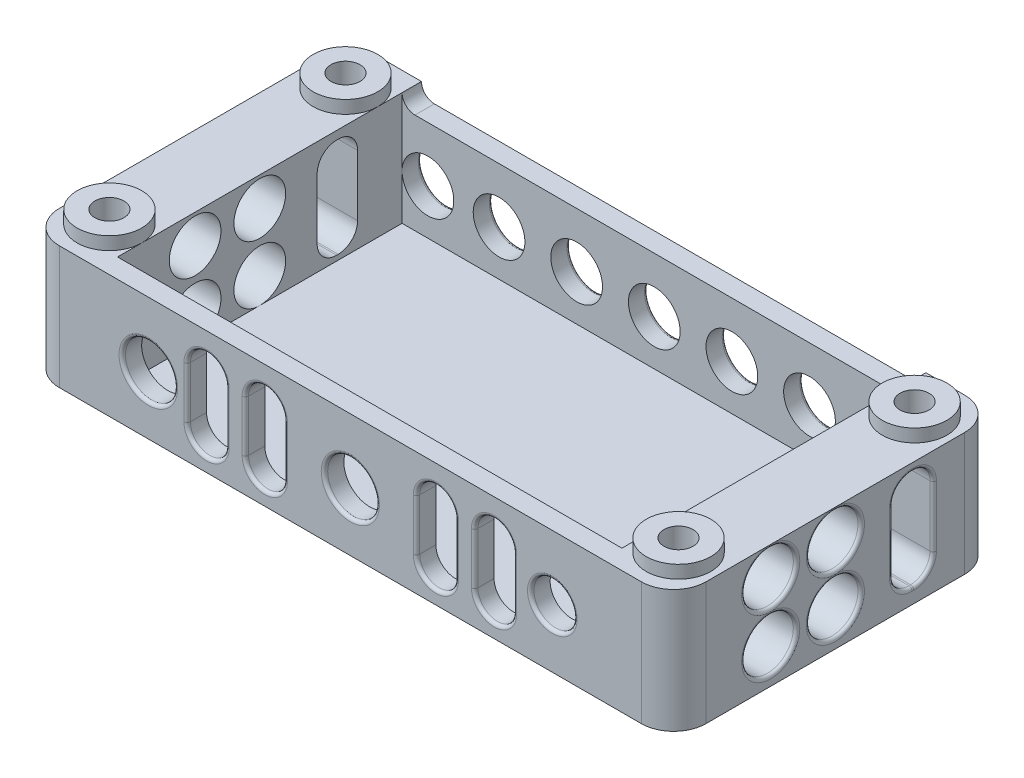
from build123d import *

# Parameters (mm, degrees)
CROQUIS1_W              = 100
CROQUIS1_H              = 50
CROQUIS1_R              = 2.25
SALIENTE_EXTRUIR2_DEPTH = 20
CROQUIS3_W              = 78
CROQUIS3_H              = 44
CORTAR_EXTRUIR1_DEPTH   = 18.5
CROQUIS4_R              = 4
CROQUIS4_W              = 6.257655616
CROQUIS4_H              = 15.417971864
CORTAR_EXTRUIR2_DEPTH   = 18.5
CROQUIS5_R              = 4
CORTAR_EXTRUIR3_DEPTH   = 18.5
REDONDEO1_R             = 5
CROQUIS8_W              = 78
CROQUIS8_H              = 3
CORTAR_EXTRUIR4_DEPTH   = 3
REDONDEO2_R             = 2
CROQUIS9_W              = 114.475750888
CROQUIS9_H              = 62.589988472
CROQUIS9_R              = 5
CORTAR_EXTRUIR6_DEPTH   = 1
REDONDEO3_R             = 3
CROQUIS12_R             = 5
CROQUIS12_R_2           = 2.25
SALIENTE_EXTRUIR4_DEPTH = 1
CROQUIS13_R             = 4
CROQUIS13_R_2           = 3.337538413
CROQUIS13_R_3           = 4.030830943
CORTAR_EXTRUIR8_DEPTH   = 10
CROQUIS14_R             = 4
CORTAR_EXTRUIR9_DEPTH   = 33
CROQUIS16_R             = 4
CORTAR_EXTRUIR10_DEPTH  = 20
REDONDEO6_R             = 0.5


with BuildPart() as part:
    # Croquis1 → Saliente-Extruir2 (new body)
    with BuildSketch(Plane(origin=(0, 0, 0), x_dir=(1, 0, 0), z_dir=(0, 1, 0))):
        Rectangle(CROQUIS1_W, CROQUIS1_H)
        with Locations(Location((-44, 18.25, 0), (0, 0, 270))):
            Circle(CROQUIS1_R, mode=Mode.SUBTRACT)
        with Locations(Location((44, 18.25, 0), (0, 0, 270))):
            Circle(CROQUIS1_R, mode=Mode.SUBTRACT)
        with Locations(Location((44, -18.25, 0), (0, 0, 270))):
            Circle(CROQUIS1_R, mode=Mode.SUBTRACT)
        with Locations(Location((-44, -18.25, 0), (0, 0, 270))):
            Circle(CROQUIS1_R, mode=Mode.SUBTRACT)
    extrude(amount=SALIENTE_EXTRUIR2_DEPTH)

    # Croquis3 → Cortar-Extruir1 (cut)
    with BuildSketch(Plane(origin=(0, 20, 0), x_dir=(1, 0, 0), z_dir=(0, 1, 0))):
        Rectangle(CROQUIS3_W, CROQUIS3_H)
    extrude(amount=-CORTAR_EXTRUIR1_DEPTH, mode=Mode.SUBTRACT)

    # Croquis4 → Cortar-Extruir2 (cut)
    with BuildSketch(Plane.ZY.offset(50)):
        with Locations((0, 14.5)):
            Circle(CROQUIS4_R)
        with Locations((10, 14.5)):
            Circle(CROQUIS4_R)
        with Locations((10, 5.5)):
            Circle(CROQUIS4_R)
        with Locations((0, 5.5)):
            Circle(CROQUIS4_R)
        with Locations((-12, 10)):
            Rectangle(CROQUIS4_W, CROQUIS4_H)
    extrude(amount=-CORTAR_EXTRUIR2_DEPTH, mode=Mode.SUBTRACT)

    # Croquis5 → Cortar-Extruir3 (cut)
    with BuildSketch(Plane.ZY.offset(-39)):
        with Locations((10, 14.5)):
            Circle(CROQUIS5_R)
        with Locations((0, 14.5)):
            Circle(CROQUIS5_R)
    extrude(amount=-CORTAR_EXTRUIR3_DEPTH, mode=Mode.SUBTRACT)

    # Redondeo1
    redondeo1_edges = [part.edges().sort_by_distance(p)[0] for p in [
        (50, 10, 25),
        (-50, 10, 25),
        (-50, 10, -25),
        (50, 10, -25),
    ]]
    fillet(redondeo1_edges, radius=REDONDEO1_R)

    # Croquis8 → Cortar-Extruir4 (cut)
    with BuildSketch(Plane(origin=(0, 20, 0), x_dir=(1, 0, 0), z_dir=(0, 1, 0))):
        with Locations((0, 23.5)):
            Rectangle(CROQUIS8_W, CROQUIS8_H)
    extrude(amount=-CORTAR_EXTRUIR4_DEPTH, mode=Mode.SUBTRACT)

    # Redondeo2
    redondeo2_edges = [part.edges().sort_by_distance(p)[0] for p in [
        (-39, 17, -23.5),
        (39, 17, -23.5),
    ]]
    fillet(redondeo2_edges, radius=REDONDEO2_R)

    # Croquis9 → Cortar-Extruir6 (cut)
    with BuildSketch(Plane(origin=(0, 20, 0), x_dir=(1, 0, 0), z_dir=(0, 1, 0))):
        Rectangle(CROQUIS9_W, CROQUIS9_H)
        with Locations(Location((44, -18.25, 0), (0, 0, 270))):
            Circle(CROQUIS9_R, mode=Mode.SUBTRACT)
        with Locations(Location((44, 18.25, 0), (0, 0, 270))):
            Circle(CROQUIS9_R, mode=Mode.SUBTRACT)
        with Locations(Location((-44, 18.25, 0), (0, 0, 270))):
            Circle(CROQUIS9_R, mode=Mode.SUBTRACT)
        with Locations(Location((-44, -18.25, 0), (0, 0, 270))):
            Circle(CROQUIS9_R, mode=Mode.SUBTRACT)
    extrude(amount=-CORTAR_EXTRUIR6_DEPTH, mode=Mode.SUBTRACT)

    # Redondeo3
    redondeo3_edges = [part.edges().sort_by_distance(p)[0] for p in [
        (-44.5, 17.708985932, -8.871172192),
        (-44.5, 2.291014068, -8.871172192),
        (-44.5, 2.291014068, -15.128827808),
        (-44.5, 17.708985932, -15.128827808),
    ]]
    fillet(redondeo3_edges, radius=REDONDEO3_R)

    # Croquis12 → Saliente-Extruir4 (add)
    # profile 1 of 4: a face of its own
    with BuildSketch(Plane(origin=(0, 20, 0), x_dir=(1, 0, 0), z_dir=(0, 1, 0))):
        with Locations(Location((44, -18.25, 0), (0, 0, 270))):
            Circle(CROQUIS12_R)
        with Locations(Location((44, -18.25, 0), (0, 0, 270))):
            Circle(CROQUIS12_R_2, mode=Mode.SUBTRACT)
    # profile 2 of 4: a face of its own
    with BuildSketch(Plane(origin=(0, 20, 0), x_dir=(1, 0, 0), z_dir=(0, 1, 0))):
        with Locations(Location((44, 18.25, 0), (0, 0, 270))):
            Circle(CROQUIS12_R)
        with Locations(Location((44, 18.25, 0), (0, 0, 270))):
            Circle(CROQUIS12_R_2, mode=Mode.SUBTRACT)
    # profile 3 of 4: a face of its own
    with BuildSketch(Plane(origin=(0, 20, 0), x_dir=(1, 0, 0), z_dir=(0, 1, 0))):
        with Locations(Location((-44, -18.25, 0), (0, 0, 270))):
            Circle(CROQUIS12_R)
        with Locations(Location((-44, -18.25, 0), (0, 0, 270))):
            Circle(CROQUIS12_R_2, mode=Mode.SUBTRACT)
    # profile 4 of 4: a face of its own
    with BuildSketch(Plane(origin=(0, 20, 0), x_dir=(1, 0, 0), z_dir=(0, 1, 0))):
        with Locations(Location((-44, 18.25, 0), (0, 0, 270))):
            Circle(CROQUIS12_R)
        with Locations(Location((-44, 18.25, 0), (0, 0, 270))):
            Circle(CROQUIS12_R_2, mode=Mode.SUBTRACT)
    extrude(amount=SALIENTE_EXTRUIR4_DEPTH)

    # Croquis13 → Cortar-Extruir8 (cut)
    with BuildSketch(Plane.XY.offset(25)):
        with Locations((0, 9.031278103)):
            Circle(CROQUIS13_R)
        with Locations((31.231612765, 9.031278103)):
            Circle(CROQUIS13_R_2)
        with Locations((-31.231612765, 9.031278103)):
            Circle(CROQUIS13_R_3)
        with BuildLine():
            Line((16.231612765, 13), (16.231612765, 5.062556207))
            ThreePointArc((16.231612765, 5.062556207), (13.231612765, 2.062556207), (10.231612765, 5.062556207))
            Line((10.231612765, 5.062556207), (10.231612765, 13))
            ThreePointArc((10.231612765, 13), (13.231612765, 16), (16.231612765, 13))
        make_face()
        with BuildLine():
            Line((-10.231612765, 13), (-10.231612765, 5.062556207))
            ThreePointArc((-10.231612765, 5.062556207), (-13.231612765, 2.062556207), (-16.231612765, 5.062556207))
            Line((-16.231612765, 5.062556207), (-16.231612765, 13))
            ThreePointArc((-16.231612765, 13), (-13.231612765, 16), (-10.231612765, 13))
        make_face()
        with BuildLine():
            Line((25.231612765, 13), (25.231612765, 5.062556207))
            ThreePointArc((25.231612765, 5.062556207), (22.231612765, 2.062556207), (19.231612765, 5.062556207))
            Line((19.231612765, 5.062556207), (19.231612765, 13))
            ThreePointArc((19.231612765, 13), (22.231612765, 16), (25.231612765, 13))
        make_face()
        with BuildLine():
            Line((-19.231612765, 13), (-19.231612765, 5.062556207))
            ThreePointArc((-19.231612765, 5.062556207), (-22.231612765, 2.062556207), (-25.231612765, 5.062556207))
            Line((-25.231612765, 5.062556207), (-25.231612765, 13))
            ThreePointArc((-25.231612765, 13), (-22.231612765, 16), (-19.231612765, 13))
        make_face()
    extrude(amount=-CORTAR_EXTRUIR8_DEPTH, mode=Mode.SUBTRACT)

    # Croquis14 → Cortar-Extruir9 (cut)
    with BuildSketch(Plane(origin=(50, 0, 0), x_dir=(0, 0, -1), z_dir=(1, 0, 0))):
        with Locations(Location((0, 5.5, 0), (0, 0, 180))):
            Circle(CROQUIS14_R)
        with Locations(Location((-10, 5.5, 0), (0, 0, 180))):
            Circle(CROQUIS14_R)
        with BuildLine():
            Line((12.128827808, 2.291014068), (11.871172192, 2.291014068))
            ThreePointArc((11.871172192, 2.291014068), (9.749851848, 3.169693724), (8.871172192, 5.291014068))
            Line((8.871172192, 5.291014068), (8.871172192, 14.708985932))
            ThreePointArc((8.871172192, 14.708985932), (9.749851848, 16.830306276), (11.871172192, 17.708985932))
            Line((11.871172192, 17.708985932), (12.128827808, 17.708985932))
            ThreePointArc((12.128827808, 17.708985932), (14.250148152, 16.830306276), (15.128827808, 14.708985932))
            Line((15.128827808, 14.708985932), (15.128827808, 5.291014068))
            ThreePointArc((15.128827808, 5.291014068), (14.250148152, 3.169693724), (12.128827808, 2.291014068))
        make_face()
    extrude(amount=-CORTAR_EXTRUIR9_DEPTH, mode=Mode.SUBTRACT)

    # Croquis16 → Cortar-Extruir10 (cut)
    with BuildSketch(Plane(origin=(0, 0, -25), x_dir=(-1, 0, 0), z_dir=(0, 0, -1))):
        with Locations((0, 8.5)):
            Circle(CROQUIS16_R)
        with Locations((12, 8.5)):
            Circle(CROQUIS16_R)
        with Locations((24, 8.5)):
            Circle(CROQUIS16_R)
        with Locations((-12, 8.5)):
            Circle(CROQUIS16_R)
        with Locations((-24, 8.5)):
            Circle(CROQUIS16_R)
        with Locations((-35, 8.5)):
            Circle(CROQUIS16_R)
        with Locations((35, 8.5)):
            Circle(CROQUIS16_R)
    extrude(amount=-CORTAR_EXTRUIR10_DEPTH, mode=Mode.SUBTRACT)

    # Redondeo6
    redondeo6_edges = [part.edges().sort_by_distance(p)[0] for p in [
        (-50, 10, -8.871172192),
        (-50, 2.291014068, -12),
        (-50, 10, -15.128827808),
        (-50, 17.708985932, -12),
        (-50, 3.169693724, -9.749851848),
        (-50, 3.169693724, -14.250148152),
        (-50, 16.830306276, -9.749851848),
        (-50, 16.830306276, -14.250148152),
        (-4, 9.031278103, 25),
        (-22.231612765, 16, 25),
        (-25.231612765, 9.031278103, 25),
        (-22.231612765, 2.062556207, 25),
        (-19.231612765, 9.031278103, 25),
        (22.231612765, 2.062556207, 25),
        (25.231612765, 9.031278103, 25),
        (22.231612765, 16, 25),
        (19.231612765, 9.031278103, 25),
        (-13.231612765, 2.062556207, 25),
        (-10.231612765, 9.031278103, 25),
        (-13.231612765, 16, 25),
        (-16.231612765, 9.031278103, 25),
        (27.894074352, 9.031278103, 25),
        (-35.262443708, 9.031278103, 25),
        (13.231612765, 16, 25),
        (10.231612765, 9.031278103, 25),
        (13.231612765, 2.062556207, 25),
        (16.231612765, 9.031278103, 25),
        (50, 3.169693724, -14.250148152),
        (50, 10, -15.128827808),
        (50, 16.830306276, -14.250148152),
        (50, 17.708985932, -12),
        (50, 16.830306276, -9.749851848),
        (50, 10, -8.871172192),
        (50, 3.169693724, -9.749851848),
        (50, 2.291014068, -12),
        (50, 5.5, -4),
        (50, 5.5, 6),
        (16, 8.5, -25),
        (4, 8.5, -25),
        (-8, 8.5, -25),
        (-20, 8.5, -25),
        (39, 8.5, -25),
        (-31, 8.5, -25),
        (28, 8.5, -25),
        (-50, 5.5, -4),
        (-50, 5.5, 6),
        (-50, 14.5, 6),
        (-50, 14.5, -4),
        (50, 14.5, 6),
        (50, 14.5, -4),
    ]]
    fillet(redondeo6_edges, radius=REDONDEO6_R - 0.0001)  # a hair under: the kernel refuses the full size


solid = part.part
